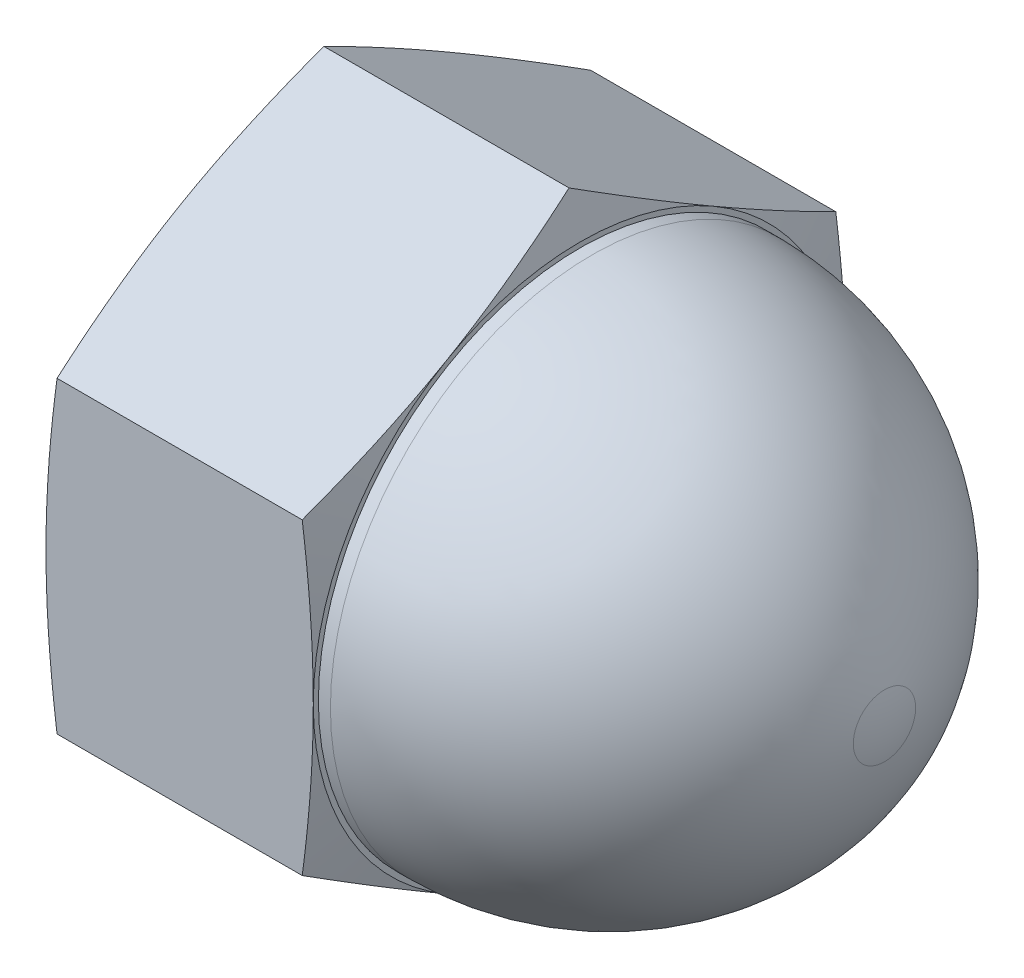
from build123d import *

# Parameters (mm, degrees)
BASENUT_DEPTH = 18.288


# Read off the part's stored shape, not the designer's step: ThreadSchematic
with BuildPart() as part:
    # BaseNutSke → BaseNut (new body)
    with BuildSketch(Plane(origin=(0, 0, 0), x_dir=(0, 0, -1), z_dir=(1, 0, 0))):
        Polygon((18.25625, 10.540250852), (18.25625, -10.540250852), (0, -21.080501704), (-18.25625, -10.540250852), (-18.25625, 10.540250852), (0, 21.080501704), align=None)
    extrude(amount=BASENUT_DEPTH)

    # Sketch3 → Crown (revolve)
    with BuildSketch(Plane.XY, mode=Mode.PRIVATE) as crown_sk:
        with BuildLine():
            Line((39.37, 0), (0, 0))
            Line((0, 0), (0, 17.907))
            Line((0, 17.907), (19.111504465, 17.907))
            ThreePointArc((19.111504465, 17.907), (31.849674106, 13.489376766), (39.117596428, 2.1336))
            ThreePointArc((39.117596428, 2.1336), (39.306679868, 1.074238861), (39.37, 0))
        make_face()
    revolve(crown_sk.sketch.rotate(Axis((0, 0, 0), (1, 0, 0)), 90), axis=Axis((0, 0, 0), (1, 0, 0)))

    # Sketch4 → DoubleChamfer (revolve, cut)
    with BuildSketch(Plane.XY, mode=Mode.PRIVATE) as doublechamfer_sk:
        Polygon((0, 18.25625), (1.955420677, 25.553979317), (16.332934387, 25.553979317), (18.288, 18.25625), (30.988, 18.25625), (30.988, 43.65625), (-12.7, 43.65625), (-12.7, 18.25625), align=None)
    revolve(doublechamfer_sk.sketch.rotate(Axis((0, 0, 0), (1, 0, 0)), 90), axis=Axis((0, 0, 0), (1, 0, 0)), mode=Mode.SUBTRACT)

    # ThreadSchematic outline → ThreadSchematic (revolve, cut)
    with BuildSketch(Plane.YX):
        Polygon((11.1125, 0), (11.1125, 28.448), (0, 35.125063629), (0, 0), align=None)
    revolve(axis=Axis((0, 0, 0), (1, 0, 0)), mode=Mode.SUBTRACT)

    # EndChamferSketch → EndChamfer (revolve, cut)
    with BuildSketch(Plane.XY, mode=Mode.PRIVATE) as endchamfer_sk:
        Polygon((-0.0254, 12.7), (0.0254, 12.7), (1.248137414, 10.95375), (-0.0254, 10.95375), align=None)
    revolve(endchamfer_sk.sketch.rotate(Axis((0, 0, 0), (-1, 0, 0)), 270), axis=Axis((0, 0, 0), (-1, 0, 0)), mode=Mode.SUBTRACT)


solid = part.part
